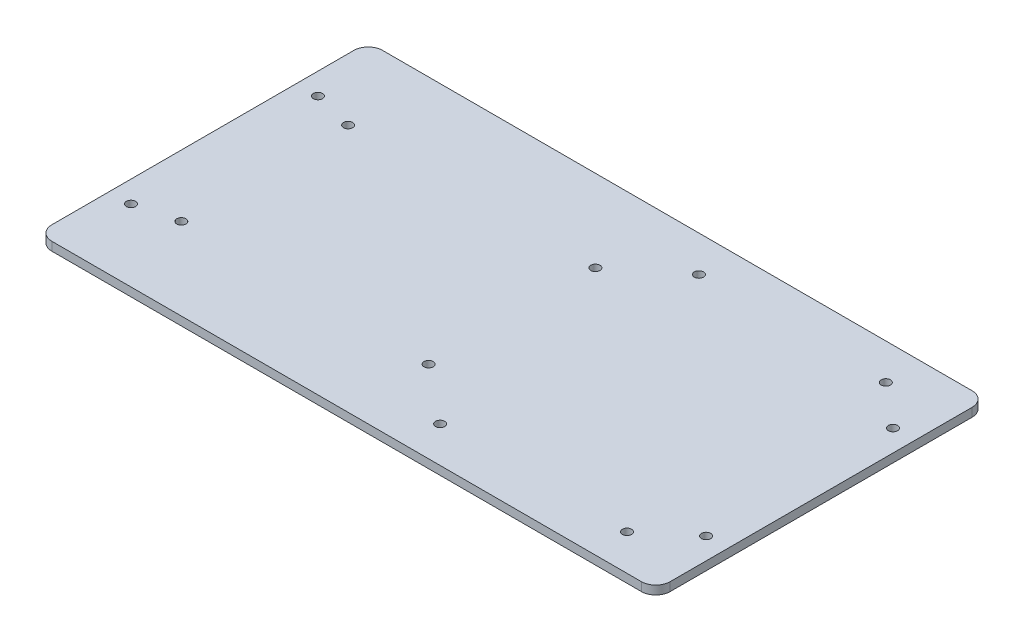
from build123d import *

# Parameters (mm, degrees)
SKETCH1_W           = 215
SKETCH1_H           = 115
SKETCH1_R           = 1.6
BOSS_EXTRUDE1_DEPTH = 3
FILLET1_R           = 5


with BuildPart() as part:
    # Sketch1 → Boss-Extrude1 (new body)
    with BuildSketch(Plane(origin=(0, 0, 0), x_dir=(1, 0, 0), z_dir=(0, 1, 0))):
        Rectangle(SKETCH1_W, SKETCH1_H)
        with Locations((100, -32.5)):
            Circle(SKETCH1_R, mode=Mode.SUBTRACT)
        with Locations((-100, -32.5)):
            Circle(SKETCH1_R, mode=Mode.SUBTRACT)
        with Locations((100, 32.5)):
            Circle(SKETCH1_R, mode=Mode.SUBTRACT)
        with Locations((-100, 32.5)):
            Circle(SKETCH1_R, mode=Mode.SUBTRACT)
        with Locations((-86, 29)):
            Circle(SKETCH1_R, mode=Mode.SUBTRACT)
        with Locations((0, 29)):
            Circle(SKETCH1_R, mode=Mode.SUBTRACT)
        with Locations((0, -29)):
            Circle(SKETCH1_R, mode=Mode.SUBTRACT)
        with Locations((-86, -29)):
            Circle(SKETCH1_R, mode=Mode.SUBTRACT)
        with Locations((20, 45)):
            Circle(SKETCH1_R, mode=Mode.SUBTRACT)
        with Locations((85, 45)):
            Circle(SKETCH1_R, mode=Mode.SUBTRACT)
        with Locations((85, -45)):
            Circle(SKETCH1_R, mode=Mode.SUBTRACT)
        with Locations((20, -45)):
            Circle(SKETCH1_R, mode=Mode.SUBTRACT)
    extrude(amount=BOSS_EXTRUDE1_DEPTH)

    # Fillet1
    fillet1_edges = [part.edges().sort_by_distance(p)[0] for p in [
        (-107.5, 1.5, -57.5),
        (107.5, 1.5, -57.5),
        (107.5, 1.5, 57.5),
        (-107.5, 1.5, 57.5),
    ]]
    fillet(fillet1_edges, radius=FILLET1_R)


solid = part.part
